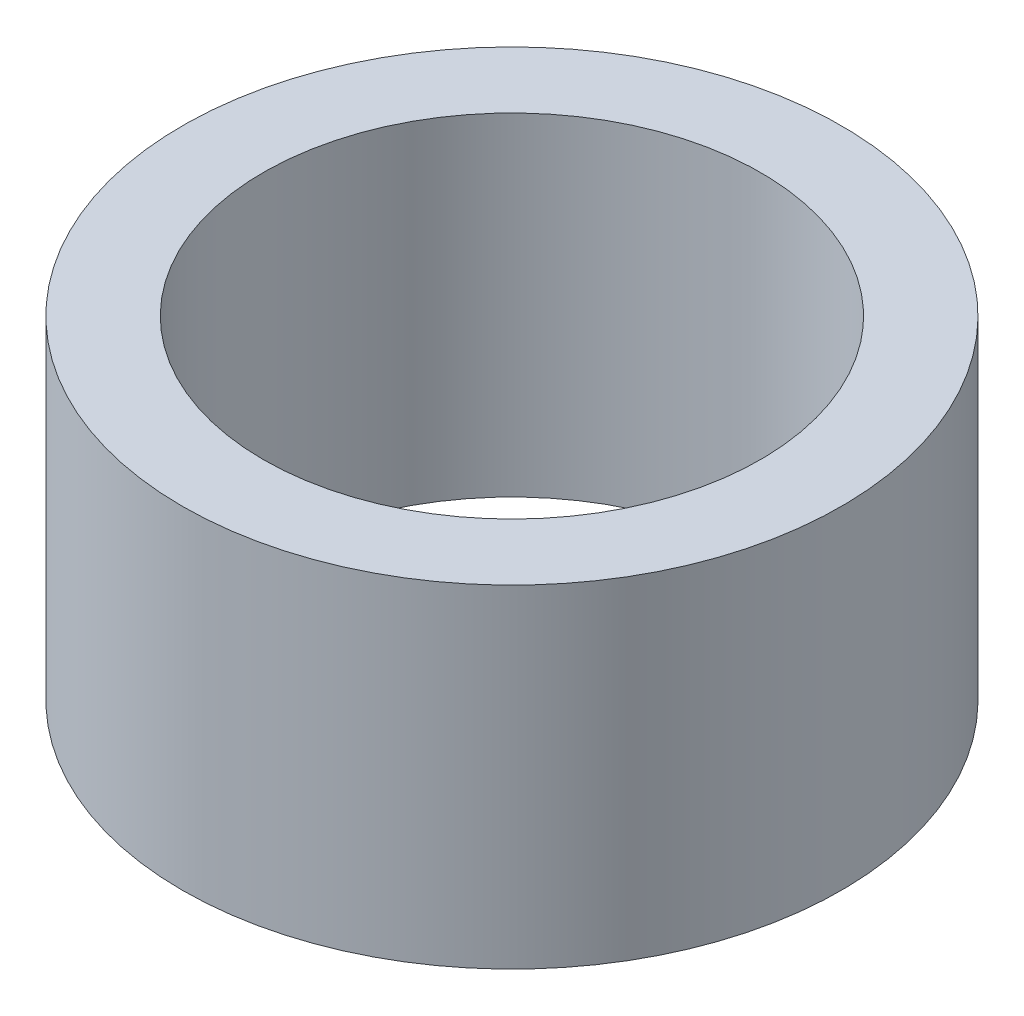
from build123d import *

# Parameters (mm, degrees)
SKETCH1_R           = 5.5
SKETCH1_R_2         = 4.15
BOSS_EXTRUDE1_DEPTH = 5.55


with BuildPart() as part:
    # Sketch1 → Boss-Extrude1 (new body)
    with BuildSketch(Plane(origin=(0, 0, 0), x_dir=(1, 0, 0), z_dir=(0, 1, 0))):
        Circle(SKETCH1_R)
        Circle(SKETCH1_R_2, mode=Mode.SUBTRACT)
    extrude(amount=BOSS_EXTRUDE1_DEPTH)


solid = part.part
